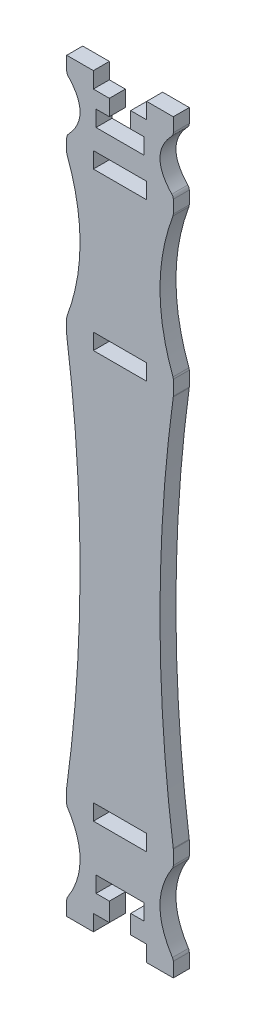
from build123d import *

# Parameters (mm, degrees)
CROQUIS1_W              = 10
CROQUIS1_H              = 3
SALIENTE_EXTRUIR1_DEPTH = 3


with BuildPart() as part:
    # Croquis1 → Saliente-Extruir1 (new body)
    with BuildSketch(Plane.XY):
        with BuildLine():
            Line((-15, -67.298618771), (-15, -70))
            Line((-15, -70), (-10, -70))
            Line((-10, -70), (-10, -67))
            Line((-10, -67), (-7, -67))
            Line((-7, -67), (-7, -63.5))
            Line((-7, -63.5), (-9.5, -63.5))
            Line((-9.5, -63.5), (-9.5, -60.5))
            Line((-9.5, -60.5), (-0.5, -60.5))
            Line((-0.5, -60.5), (-0.5, -63.5))
            Line((-0.5, -63.5), (-3, -63.5))
            Line((-3, -63.5), (-3, -67))
            Line((-3, -67), (0, -67))
            Line((0, -67), (0, -70))
            Line((0, -70), (5, -70))
            Line((5, -70), (5, -67.298618771))
            ThreePointArc((5, -67.298618771), (4.959256868, -67.016083354), (4.840347477, -66.756570693))
            add(Edge.make_bspline(
                [(4.840347477, -66.756570693), (3.280115826, -64.337713796), (1.719884174, -59.5), (3.280115826, -54.662286204), (4.840347477, -52.243429307)],
                knots=[0.01622862, 0.01622862, 0.01622862, 0.01622862, 0.5, 0.98377138, 0.98377138, 0.98377138, 0.98377138], degree=3))
            ThreePointArc((4.840347477, -52.243429307), (4.959256868, -51.983916646), (5, -51.701381229))
            Line((5, -51.701381229), (5, -49.067654138))
            ThreePointArc((5, -49.067654138), (4.997723384, -49.000214919), (4.990903903, -48.933082766))
            add(Edge.make_bspline(
                [(4.990903903, -48.933082766), (3.330301301, -36.70538851), (1.669698699, -12.25), (3.330301301, 12.20538851), (4.990903903, 24.433082766)],
                knots=[0.000910439, 0.000910439, 0.000910439, 0.000910439, 0.5, 0.999089561, 0.999089561, 0.999089561, 0.999089561], degree=3))
            ThreePointArc((4.990903903, 24.433082766), (4.997723384, 24.500214919), (5, 24.567654138))
            Line((5, 24.567654138), (5, 27.318685829))
            ThreePointArc((5, 27.318685829), (4.9841425, 27.496065477), (4.937072921, 27.667819529))
            add(Edge.make_bspline(
                [(4.937072921, 53.832180471), (3.31235764, 49.471453647), (1.68764236, 40.75), (3.31235764, 32.028546353), (4.937072921, 27.667819529)],
                knots=[0.006332812, 0.006332812, 0.006332812, 0.006332812, 0.5, 0.993667188, 0.993667188, 0.993667188, 0.993667188], degree=3))
            ThreePointArc((4.937072921, 53.832180471), (4.9841425, 54.003934523), (5, 54.181314171))
            Line((5, 54.181314171), (5, 56.594252373))
            ThreePointArc((5, 56.594252373), (4.929306729, 56.963561191), (4.727221995, 57.280654712))
            add(Edge.make_bspline(
                [(4.727221995, 66.719345288), (3.242407332, 65.146230192), (1.757592668, 62), (3.242407332, 58.853769808), (4.727221995, 57.280654712)],
                knots=[0.028065471, 0.028065471, 0.028065471, 0.028065471, 0.5, 0.971934529, 0.971934529, 0.971934529, 0.971934529], degree=3))
            ThreePointArc((4.727221995, 66.719345288), (4.929306729, 67.036438809), (5, 67.405747627))
            Line((5, 67.405747627), (5, 70))
            Line((5, 70), (0, 70))
            Line((0, 70), (0, 67))
            Line((0, 67), (-3, 67))
            Line((-3, 67), (-3, 64))
            Line((-3, 64), (-0.5, 64))
            Line((-0.5, 64), (-0.5, 61))
            Line((-0.5, 61), (-9.5, 61))
            Line((-9.5, 61), (-9.5, 64))
            Line((-9.5, 64), (-7, 64))
            Line((-7, 64), (-7, 67))
            Line((-7, 67), (-10, 67))
            Line((-10, 67), (-10, 70))
            Line((-10, 70), (-15, 70))
            Line((-15, 70), (-15, 67.405747627))
            ThreePointArc((-15, 67.405747627), (-14.929306729, 67.036438809), (-14.727221995, 66.719345288))
            add(Edge.make_bspline(
                [(-14.727221995, 57.280654712), (-13.242407332, 58.853769808), (-11.757592668, 62), (-13.242407332, 65.146230192), (-14.727221995, 66.719345288)],
                knots=[0.028065471, 0.028065471, 0.028065471, 0.028065471, 0.5, 0.971934529, 0.971934529, 0.971934529, 0.971934529], degree=3))
            ThreePointArc((-14.727221995, 57.280654712), (-14.929306729, 56.963561191), (-15, 56.594252373))
            Line((-15, 56.594252373), (-15, 54.181314171))
            ThreePointArc((-15, 54.181314171), (-14.9841425, 54.003934523), (-14.937072921, 53.832180471))
            add(Edge.make_bspline(
                [(-14.937072921, 53.832180471), (-13.31235764, 49.471453647), (-11.68764236, 40.75), (-13.31235764, 32.028546353), (-14.937072921, 27.667819529)],
                knots=[0.006332812, 0.006332812, 0.006332812, 0.006332812, 0.5, 0.993667188, 0.993667188, 0.993667188, 0.993667188], degree=3))
            ThreePointArc((-14.937072921, 27.667819529), (-14.9841425, 27.496065477), (-15, 27.318685829))
            Line((-15, 27.318685829), (-15, 24.567654138))
            ThreePointArc((-15, 24.567654138), (-14.997723384, 24.500214919), (-14.990903903, 24.433082766))
            add(Edge.make_bspline(
                [(-14.990903903, -48.933082766), (-13.330301301, -36.70538851), (-11.669698699, -12.25), (-13.330301301, 12.20538851), (-14.990903903, 24.433082766)],
                knots=[0.000910439, 0.000910439, 0.000910439, 0.000910439, 0.5, 0.999089561, 0.999089561, 0.999089561, 0.999089561], degree=3))
            ThreePointArc((-14.990903903, -48.933082766), (-14.997723384, -49.000214919), (-15, -49.067654138))
            Line((-15, -49.067654138), (-15, -51.701381229))
            ThreePointArc((-15, -51.701381229), (-14.959256868, -51.983916646), (-14.840347477, -52.243429307))
            add(Edge.make_bspline(
                [(-14.840347477, -66.756570693), (-13.280115826, -64.337713796), (-11.719884174, -59.5), (-13.280115826, -54.662286204), (-14.840347477, -52.243429307)],
                knots=[0.01622862, 0.01622862, 0.01622862, 0.01622862, 0.5, 0.98377138, 0.98377138, 0.98377138, 0.98377138], degree=3))
            ThreePointArc((-14.840347477, -66.756570693), (-14.959256868, -67.016083354), (-15, -67.298618771))
        make_face()
        with Locations((-5, -50.5)):
            Rectangle(CROQUIS1_W, CROQUIS1_H, mode=Mode.SUBTRACT)
        with Locations((-5, 26)):
            Rectangle(CROQUIS1_W, CROQUIS1_H, mode=Mode.SUBTRACT)
        with Locations((-5, 55.5)):
            Rectangle(CROQUIS1_W, CROQUIS1_H, mode=Mode.SUBTRACT)
    extrude(amount=SALIENTE_EXTRUIR1_DEPTH)


solid = part.part
